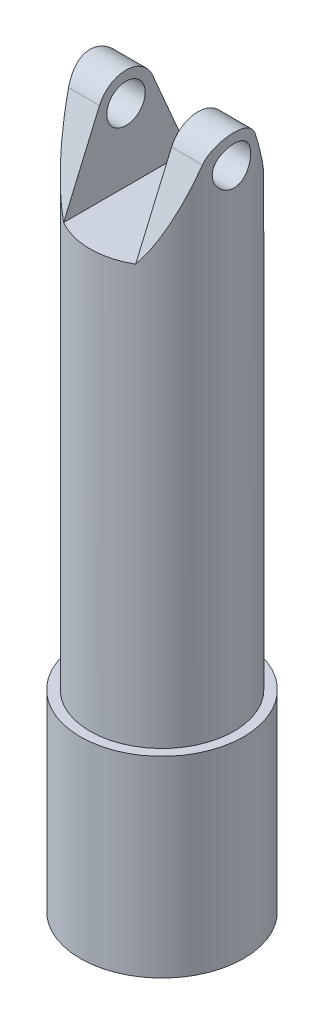
from build123d import *

# Parameters (mm, degrees)
SKETCH_1_R          = 17
EXTRUDE_1_DEPTH     = 40
SKETCH_2_R          = 15
EXTRUDE_2_DEPTH     = 110
SKETCH_3_W          = 15
SKETCH_3_H          = 46
CUT_EXTRUDE_1_DEPTH = 15
SKETCH_4_R          = 4
CUT_EXTRUDE_2_DEPTH = 15
CUT_EXTRUDE_4_DEPTH = 15


with BuildPart() as part:
    # 草图1 → 凸台-拉伸1 (new body)
    with BuildSketch(Plane(origin=(0, 0, 0), x_dir=(1, 0, 0), z_dir=(0, 1, 0))):
        Circle(SKETCH_1_R)
    extrude(amount=EXTRUDE_1_DEPTH)

    # 草图2 → 凸台-拉伸2 (add)
    with BuildSketch(Plane(origin=(0, 40, 0), x_dir=(1, 0, 0), z_dir=(0, 1, 0))):
        Circle(SKETCH_2_R)
    extrude(amount=EXTRUDE_2_DEPTH)

    # 草图3 → 切除-拉伸1 (cut, symmetric)
    with BuildSketch(Plane.XY):
        with Locations((0, 150)):
            Rectangle(SKETCH_3_W, SKETCH_3_H)
    extrude(amount=CUT_EXTRUDE_1_DEPTH, both=True, mode=Mode.SUBTRACT)

    # 草图4 → 切除-拉伸2 (cut, symmetric)
    with BuildSketch(Plane(origin=(0, 0, 0), x_dir=(0, 0, -1), z_dir=(1, 0, 0))):
        with Locations((0, 142)):
            Circle(SKETCH_4_R)
    extrude(amount=CUT_EXTRUDE_2_DEPTH, both=True, mode=Mode.SUBTRACT)

    # 草图8 → 切除-拉伸4 (cut, symmetric)
    with BuildSketch(Plane(origin=(0, 0, 0), x_dir=(0, 0, -1), z_dir=(1, 0, 0))):
        with BuildLine():
            Line((-12.990381057, 127), (-5.510956055, 144.372627943))
            ThreePointArc((-5.510956055, 144.372627943), (0, 148), (5.510956055, 144.372627943))
            Line((5.510956055, 144.372627943), (12.990381057, 127))
            Line((12.990381057, 127), (12.990381057, 150))
            Line((12.990381057, 150), (-12.990381057, 150))
            Line((-12.990381057, 150), (-12.990381057, 127))
        make_face()
    extrude(amount=CUT_EXTRUDE_4_DEPTH, both=True, mode=Mode.SUBTRACT)


solid = part.part
